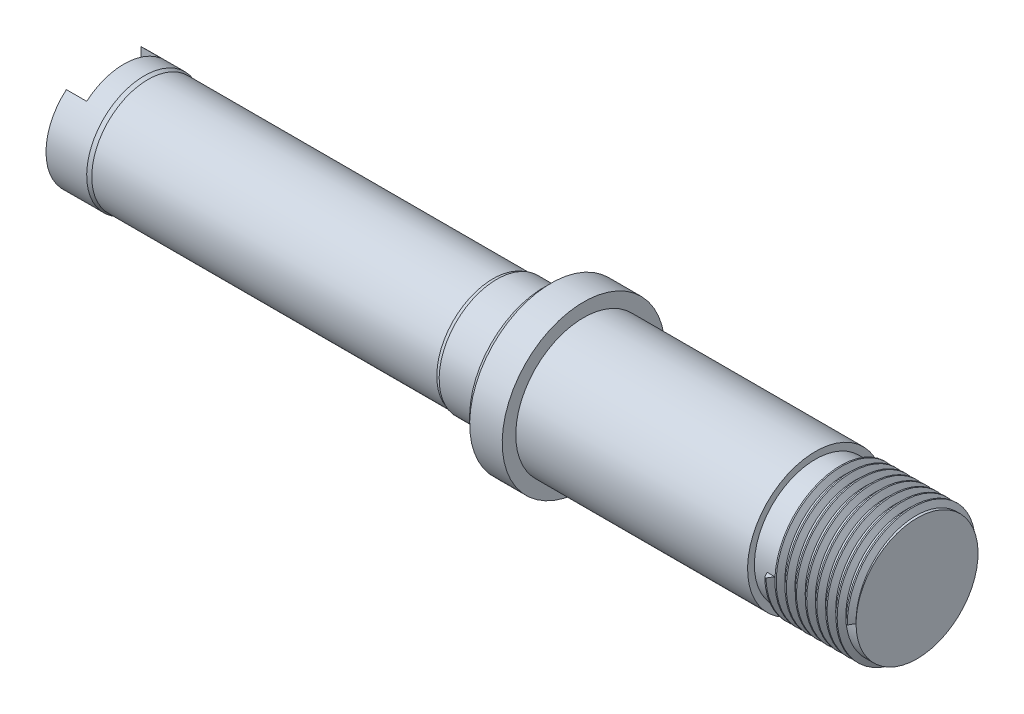
from build123d import *
from build123d.topology import SkipClean

# Parameters (mm, degrees)
THREAD1_PITCH      = 1.5
THREAD2_PITCH      = 1.5
SKETCH29_W         = 3
SKETCH29_H         = 11
CUT_EXTRUDE1_DEPTH = 10


with BuildPart() as part:
    # Sketch1 → Revolve1 (revolve)
    with BuildSketch(Plane.XY, mode=Mode.PRIVATE) as revolve1_sk:
        Polygon((0, 8.5), (0, 5), (27, 5), (32, 0), (120, 0), (120, 9), (108, 9), (105, 9), (105, 10), (93.327883988, 10), (87.458915587, 10), (70.8, 10), (70.8, 12), (66, 12), (65, 11), (65, 8.5), (58, 8.5), (57.45, 8.3), (6.55, 8.3), (6, 8.5), align=None)
    revolve(revolve1_sk.sketch.rotate(Axis((32, 0, 0), (1, 0, 0)), 180), axis=Axis((32, 0, 0), (1, 0, 0)))

    # Thread1: the profile of Thread Profile6 profile screwed along a right-hand helix of 8 turns, 8 arcs to a turn; built about Z, then put on its axis
    with SkipClean():  # the faces are left unmerged after this step: merging them gives an invalid solid
        thread1_z = Axis((0, 0, 0), (0, 0, 1))
        thread1_corners = [(8.9997, 0, -0.000173205), (9.811898813, 0, 0.468749998), (9.811898813, 0, 0.656249998), (8.9997, 0, 1.125173201)]
        with BuildLine(mode=Mode.PRIVATE) as thread1_profile:
            Line(thread1_corners[0], thread1_corners[1])
            Line(thread1_corners[1], thread1_corners[2])
            Line(thread1_corners[2], thread1_corners[3])
            Line(thread1_corners[3], thread1_corners[0])
        thread1_cap = Face(thread1_profile.wire())
        thread1_turn_angles = [0, 22.5, 45, 67.5, 90, 112.5, 135, 157.5, 180, 202.5, 225, 247.5, 270, 292.5, 315, 337.5, 360]
        thread1_turn_weights = [1, 0.9238795325112867, 1, 0.9238795325112867, 1, 0.9238795325112867, 1, 0.9238795325112867, 1, 0.9238795325112867, 1, 0.9238795325112867, 1, 0.9238795325112867, 1, 0.9238795325112867, 1]
        thread1_turn_rails = [Edge.make_bspline([Vector(p[0], p[1], 0).rotate(thread1_z, thread1_turn_angles[k]) / thread1_turn_weights[k] + Vector(0, 0, p[2] + THREAD1_PITCH * thread1_turn_angles[k] / 360) for k in range(17)], [0, 0, 0, 1, 1, 2, 2, 3, 3, 4, 4, 5, 5, 6, 6, 7, 7, 8, 8, 8], 2, thread1_turn_weights) for p in thread1_corners]
        thread1_turn_sides = [Face.make_surface_from_curves(thread1_turn_rails[p[0]], thread1_turn_rails[p[1]]) for p in [(0, 1), (1, 2), (2, 3), (3, 0)]]
        thread1 = Plane(origin=(120, 0, 0), x_dir=(0, 0, 1), z_dir=(-1, 0, 0)) * Solid(Shell([*[p.moved(Location((0, 0, THREAD1_PITCH * i))) for i in range(8) for p in thread1_turn_sides], thread1_cap, thread1_cap.rotate(thread1_z, 2880).moved(Location((0, 0, THREAD1_PITCH * 2880 / 360)))]))
        add(thread1)

    # Thread2: the profile of Thread Profile7 profile screwed along a right-hand helix of 12.666667 turns, 8 arcs to a turn; built about Z, then put on its axis
    with SkipClean():  # the faces are left unmerged after this step: merging them gives an invalid solid
        thread2_z = Axis((0, 0, 0), (0, 0, 1))
        thread2_corners = [(4.9997, 0, -0.000173205), (5.811898812, 0, 0.468749998), (5.811898812, 0, 0.656249998), (4.9997, 0, 1.125173201)]
        with BuildLine(mode=Mode.PRIVATE) as thread2_profile:
            Line(thread2_corners[0], thread2_corners[1])
            Line(thread2_corners[1], thread2_corners[2])
            Line(thread2_corners[2], thread2_corners[3])
            Line(thread2_corners[3], thread2_corners[0])
        thread2_cap = Face(thread2_profile.wire())
        thread2_turn_angles = [0, 22.5, 45, 67.5, 90, 112.5, 135, 157.5, 180, 202.5, 225, 247.5, 270, 292.5, 315, 337.5, 360]
        thread2_turn_weights = [1, 0.9238795325112867, 1, 0.9238795325112867, 1, 0.9238795325112867, 1, 0.9238795325112867, 1, 0.9238795325112867, 1, 0.9238795325112867, 1, 0.9238795325112867, 1, 0.9238795325112867, 1]
        thread2_turn_rails = [Edge.make_bspline([Vector(p[0], p[1], 0).rotate(thread2_z, thread2_turn_angles[k]) / thread2_turn_weights[k] + Vector(0, 0, p[2] + THREAD2_PITCH * thread2_turn_angles[k] / 360) for k in range(17)], [0, 0, 0, 1, 1, 2, 2, 3, 3, 4, 4, 5, 5, 6, 6, 7, 7, 8, 8, 8], 2, thread2_turn_weights) for p in thread2_corners]
        thread2_turn_sides = [Face.make_surface_from_curves(thread2_turn_rails[p[0]], thread2_turn_rails[p[1]]) for p in [(0, 1), (1, 2), (2, 3), (3, 0)]]
        thread2_last_angles = [4320, 4342.5, 4365, 4387.5, 4410, 4432.5, 4455, 4477.5, 4500, 4522.5, 4545, 4552.5, 4560]
        thread2_last_weights = [1, 0.9238795325112867, 1, 0.9238795325112867, 1, 0.9238795325112867, 1, 0.9238795325112867, 1, 0.9238795325112867, 1, 0.9914448613738115, 1]
        thread2_last_rails = [Edge.make_bspline([Vector(p[0], p[1], 0).rotate(thread2_z, thread2_last_angles[k]) / thread2_last_weights[k] + Vector(0, 0, p[2] + THREAD2_PITCH * thread2_last_angles[k] / 360) for k in range(13)], [0, 0, 0, 1, 1, 2, 2, 3, 3, 4, 4, 5, 5, 6, 6, 6], 2, thread2_last_weights) for p in thread2_corners]
        thread2_last_sides = [Face.make_surface_from_curves(thread2_last_rails[p[0]], thread2_last_rails[p[1]]) for p in [(0, 1), (1, 2), (2, 3), (3, 0)]]
        thread2 = Plane(origin=(-2, 0, 0), x_dir=(0, 0, -1), z_dir=(1, 0, 0)) * Solid(Shell([*[p.moved(Location((0, 0, THREAD2_PITCH * i))) for i in range(12) for p in thread2_turn_sides], *thread2_last_sides, thread2_cap, thread2_cap.rotate(thread2_z, 4560).moved(Location((0, 0, THREAD2_PITCH * 4560 / 360)))]))
        add(thread2, mode=Mode.SUBTRACT)

    # Sketch29 → Cut-Extrude1 (cut, symmetric)
    with SkipClean():  # the faces are left unmerged after this step: merging them gives an invalid solid
        with BuildSketch(Plane(origin=(0, 0, 0), x_dir=(1, 0, 0), z_dir=(0, 1, 0))):
            with Locations((1.5, 0)):
                Rectangle(SKETCH29_W, SKETCH29_H)
        extrude(amount=CUT_EXTRUDE1_DEPTH, both=True, mode=Mode.SUBTRACT)


solid = part.part
